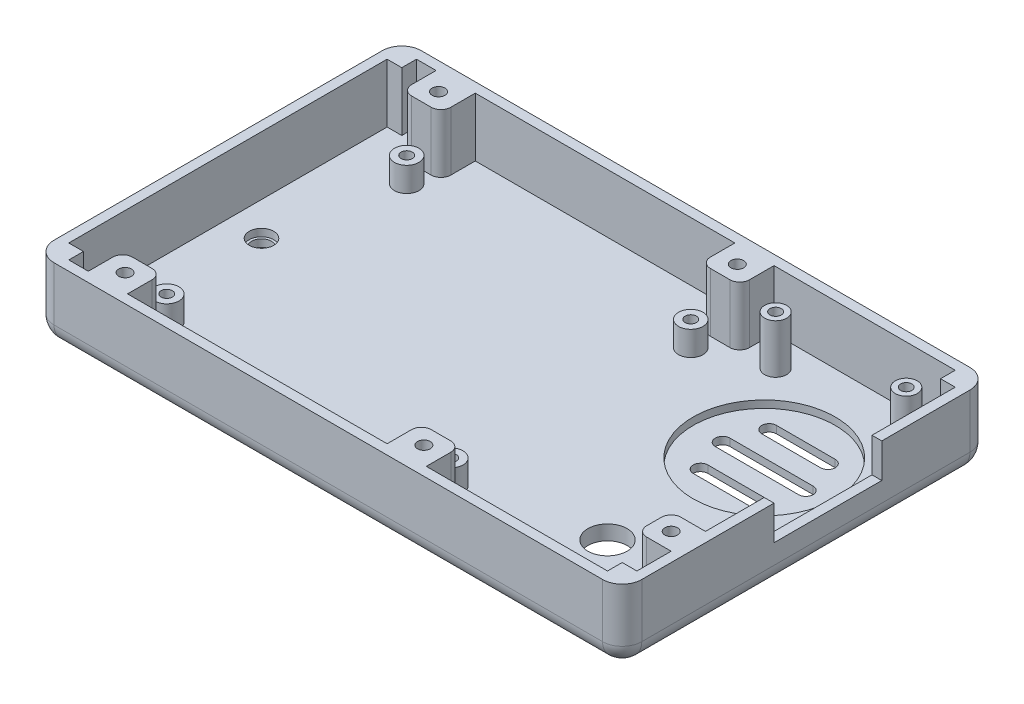
from build123d import *

# Parameters (mm, degrees)
SKETCH1_W                   = 120
SKETCH1_H                   = 75
MAIN_STRUCTURE_DEPTH        = 15
SKETCH2_W                   = 116
SKETCH2_H                   = 71
INSIDE_CUT_DEPTH            = 12
SKETCH3_R                   = 2.5
SKETCH3_R_2                 = 1.15
PI_STANDOFFS_DEPTH          = 5
SKETCH4_R                   = 2
SKETCH4_R_2                 = 0.9
CAMERA_STANDOFFS_DEPTH      = 5
BODY_FILLET_1_R             = 4
BODY_FILLET_2_R             = 4
BODY_FILLET_3_R             = 4
BODY_FILLET_4_R             = 4
SKETCH5_R                   = 2.25
SKETCH5_R_2                 = 1.15
FONA_STANDOFFS_DEPTH        = 10
SKETCH6_W                   = 3
SKETCH6_H                   = 3
CORNER_SUPPORT_DEPTH        = 12
SKETCH8_W                   = 22
SKETCH8_H                   = 7
CHARGER_CUTOUT_DEPTH        = 10
SKETCH9_W                   = 8
SKETCH9_H                   = 7
SKETCH9_W_2                 = 7
MOUNTING_STRUCTURE_DEPTH    = 12
MOUNTING_STRUCTURE_FILLET_R = 2
SKETCH10_R                  = 1.3
CASE_MOUNTING_HOLES_DEPTH   = 15
SKETCH13_R                  = 2.9
CASE_SCREW_HEAD_HOLES_DEPTH = 8.85
SKETCH14_R                  = 14.5
SPEAKER_HOLDER_DEPTH        = 1.5
SOUND_CUTOUT_DEPTH          = 1.5
SKETCH25_R                  = 2.5
MICROPHONE_HOLDER_DEPTH     = 1.5
SKETCH26_R                  = 2
MICROPHONE_CUTOUT_DEPTH     = 1.5
SKETCH27_R                  = 4
CAMERA_CUTOUT_DEPTH         = 10


with BuildPart() as part:
    # Sketch1 → Main Structure (new body)
    with BuildSketch(Plane(origin=(0, 0, 0), x_dir=(1, 0, 0), z_dir=(0, 1, 0))):
        Rectangle(SKETCH1_W, SKETCH1_H)
    extrude(amount=MAIN_STRUCTURE_DEPTH)

    # Sketch2 → Inside Cut (cut)
    with BuildSketch(Plane(origin=(0, 15, 0), x_dir=(1, 0, 0), z_dir=(0, 1, 0))):
        Rectangle(SKETCH2_W, SKETCH2_H)
    extrude(amount=-INSIDE_CUT_DEPTH, mode=Mode.SUBTRACT)

    # Sketch3 → Pi Standoffs (add)
    # profile 1 of 4: a face of its own
    with BuildSketch(Plane(origin=(0, 3, 0), x_dir=(1, 0, 0), z_dir=(0, 1, 0))):
        with Locations((-46, -24.5)):
            Circle(SKETCH3_R)
        with Locations((-46, -24.5)):
            Circle(SKETCH3_R_2, mode=Mode.SUBTRACT)
    # profile 2 of 4: a face of its own
    with BuildSketch(Plane(origin=(0, 3, 0), x_dir=(1, 0, 0), z_dir=(0, 1, 0))):
        with Locations((-46, 24.5)):
            Circle(SKETCH3_R)
        with Locations((-46, 24.5)):
            Circle(SKETCH3_R_2, mode=Mode.SUBTRACT)
    # profile 3 of 4: a face of its own
    with BuildSketch(Plane(origin=(0, 3, 0), x_dir=(1, 0, 0), z_dir=(0, 1, 0))):
        with Locations((12, 24.5)):
            Circle(SKETCH3_R)
        with Locations((12, 24.5)):
            Circle(SKETCH3_R_2, mode=Mode.SUBTRACT)
    # profile 4 of 4: a face of its own
    with BuildSketch(Plane(origin=(0, 3, 0), x_dir=(1, 0, 0), z_dir=(0, 1, 0))):
        with Locations((12, -24.5)):
            Circle(SKETCH3_R)
        with Locations((12, -24.5)):
            Circle(SKETCH3_R_2, mode=Mode.SUBTRACT)
    extrude(amount=PI_STANDOFFS_DEPTH)

    # Sketch4 → Camera Standoffs (add)
    # profile 1 of 2: a face of its own
    with BuildSketch(Plane(origin=(0, 3, 0), x_dir=(1, 0, 0), z_dir=(0, 1, 0))):
        with Locations((48, -30.5)):
            Circle(SKETCH4_R)
        with Locations((48, -30.5)):
            Circle(SKETCH4_R_2, mode=Mode.SUBTRACT)
    # profile 2 of 2: a face of its own
    with BuildSketch(Plane(origin=(0, 3, 0), x_dir=(1, 0, 0), z_dir=(0, 1, 0))):
        with Locations((48, -17.5)):
            Circle(SKETCH4_R)
        with Locations((48, -17.5)):
            Circle(SKETCH4_R_2, mode=Mode.SUBTRACT)
    extrude(amount=CAMERA_STANDOFFS_DEPTH)

    # Body Fillet 1
    body_fillet_1_edges = [part.edges().sort_by_distance(p)[0] for p in [
        (-60, 0, 0),
    ]]
    fillet(body_fillet_1_edges, radius=BODY_FILLET_1_R)

    # Body Fillet 2
    body_fillet_2_edges = [part.edges().sort_by_distance(p)[0] for p in [
        (-60, 9.5, -37.5),
        (-58.828427125, 1.171572875, -37.5),
        (2, 0, -37.5),
    ]]
    fillet(body_fillet_2_edges, radius=BODY_FILLET_2_R)

    # Body Fillet 3
    body_fillet_3_edges = [part.edges().sort_by_distance(p)[0] for p in [
        (-60, 9.5, 37.5),
        (-58.828427125, 1.171572875, 37.5),
        (2, 0, 37.5),
    ]]
    fillet(body_fillet_3_edges, radius=BODY_FILLET_3_R)

    # Body Fillet 4
    body_fillet_4_edges = [part.edges().sort_by_distance(p)[0] for p in [
        (60, 9.5, 37.5),
        (60, 1.171572875, 36.328427125),
        (60, 9.5, -37.5),
        (60, 1.171572875, -36.328427125),
        (60, 0, 0),
    ]]
    fillet(body_fillet_4_edges, radius=BODY_FILLET_4_R)

    # Sketch5 → Fona Standoffs (add)
    # profile 1 of 2: a face of its own
    with BuildSketch(Plane(origin=(0, 3, 0), x_dir=(1, 0, 0), z_dir=(0, 1, 0))):
        with Locations((24.33, 29.5)):
            Circle(SKETCH5_R)
        with Locations((24.33, 29.5)):
            Circle(SKETCH5_R_2, mode=Mode.SUBTRACT)
    # profile 2 of 2: a face of its own
    with BuildSketch(Plane(origin=(0, 3, 0), x_dir=(1, 0, 0), z_dir=(0, 1, 0))):
        with Locations((51, 29.5)):
            Circle(SKETCH5_R)
        with Locations((51, 29.5)):
            Circle(SKETCH5_R_2, mode=Mode.SUBTRACT)
    extrude(amount=FONA_STANDOFFS_DEPTH)

    # Sketch6 → Corner Support (add)
    with BuildSketch(Plane(origin=(0, 3, 0), x_dir=(1, 0, 0), z_dir=(0, 1, 0))):
        with Locations((-56.5, -34)):
            Rectangle(SKETCH6_W, SKETCH6_H)
        with Locations((-56.5, 34)):
            Rectangle(SKETCH6_W, SKETCH6_H)
        with Locations((56.5, -34)):
            Rectangle(SKETCH6_W, SKETCH6_H)
        with Locations((56.5, 34)):
            Rectangle(SKETCH6_W, SKETCH6_H)
    extrude(amount=CORNER_SUPPORT_DEPTH)

    # Sketch8 → Charger Cutout (cut)
    with BuildSketch(Plane(origin=(60, 0, 0), x_dir=(0, 0, -1), z_dir=(1, 0, 0))):
        with Locations((4.5, 11.5)):
            Rectangle(SKETCH8_W, SKETCH8_H)
    extrude(amount=-CHARGER_CUTOUT_DEPTH, mode=Mode.SUBTRACT)

    # Sketch9 → Mounting Structure (add)
    with BuildSketch(Plane(origin=(0, 3, 0), x_dir=(1, 0, 0), z_dir=(0, 1, 0))):
        with Locations((-47, -32)):
            Rectangle(SKETCH9_W, SKETCH9_H)
        with Locations((54.5, -22)):
            Rectangle(SKETCH9_W_2, SKETCH9_H)
        with Locations((-47, 32)):
            Rectangle(SKETCH9_W, SKETCH9_H)
        with Locations((14, 32)):
            Rectangle(SKETCH9_W, SKETCH9_H)
        with Locations((14, -32)):
            Rectangle(SKETCH9_W, SKETCH9_H)
    extrude(amount=MOUNTING_STRUCTURE_DEPTH)

    # Mounting Structure Fillet
    mounting_structure_fillet_edges = [part.edges().sort_by_distance(p)[0] for p in [
        (-43, 9, -28.5),
        (-51, 9, -28.5),
        (10, 9, -28.5),
        (18, 9, -28.5),
        (10, 9, 28.5),
        (18, 9, 28.5),
        (-51, 9, 28.5),
        (-43, 9, 28.5),
        (51, 9, 18.5),
        (51, 9, 25.5),
    ]]
    fillet(mounting_structure_fillet_edges, radius=MOUNTING_STRUCTURE_FILLET_R)

    # Sketch10 → Case Mounting Holes (cut)
    with BuildSketch(Plane(origin=(0, 15, 0), x_dir=(1, 0, 0), z_dir=(0, 1, 0))):
        with Locations((-47, 32)):
            Circle(SKETCH10_R)
        with Locations((-47, -32)):
            Circle(SKETCH10_R)
        with Locations((14, -32)):
            Circle(SKETCH10_R)
        with Locations((14, 32)):
            Circle(SKETCH10_R)
        with Locations((54.5, -22)):
            Circle(SKETCH10_R)
    extrude(amount=-CASE_MOUNTING_HOLES_DEPTH, mode=Mode.SUBTRACT)

    # Sketch13 → Case Screw Head Holes (cut)
    with BuildSketch(Plane.XZ):
        with Locations((-47, 32)):
            Circle(SKETCH13_R)
        with Locations((14, 32)):
            Circle(SKETCH13_R)
        with Locations((14, -32)):
            Circle(SKETCH13_R)
        with Locations((-47, -32)):
            Circle(SKETCH13_R)
        with Locations((54.5, 22)):
            Circle(SKETCH13_R)
    extrude(amount=-CASE_SCREW_HEAD_HOLES_DEPTH, mode=Mode.SUBTRACT)

    # Sketch14 → Speaker Holder (cut)
    with BuildSketch(Plane(origin=(0, 3, 0), x_dir=(1, 0, 0), z_dir=(0, 1, 0))):
        with Locations((39, 12.5)):
            Circle(SKETCH14_R)
    extrude(amount=-SPEAKER_HOLDER_DEPTH, mode=Mode.SUBTRACT)

    # Sketch23 → Sound Cutout (cut)
    with BuildSketch(Plane(origin=(0, 1.5, 0), x_dir=(1, 0, 0), z_dir=(0, 1, 0))):
        with BuildLine():
            Line((33, 21), (45, 21))
            ThreePointArc((45, 21), (46.5, 19.5), (45, 18))
            Line((45, 18), (33, 18))
            ThreePointArc((33, 18), (31.5, 19.5), (33, 21))
        make_face()
        with BuildLine():
            Line((30.5, 14), (47.5, 14))
            ThreePointArc((47.5, 14), (49, 12.5), (47.5, 11))
            Line((47.5, 11), (30.5, 11))
            ThreePointArc((30.5, 11), (29, 12.5), (30.5, 14))
        make_face()
        with BuildLine():
            Line((33, 7), (45, 7))
            ThreePointArc((45, 7), (46.5, 5.5), (45, 4))
            Line((45, 4), (33, 4))
            ThreePointArc((33, 4), (31.5, 5.5), (33, 7))
        make_face()
    extrude(amount=-SOUND_CUTOUT_DEPTH, mode=Mode.SUBTRACT)

    # Sketch25 → Microphone holder (cut)
    with BuildSketch(Plane(origin=(0, 3, 0), x_dir=(1, 0, 0), z_dir=(0, 1, 0))):
        with Locations((-51.147743093, 0)):
            Circle(SKETCH25_R)
    extrude(amount=-MICROPHONE_HOLDER_DEPTH, mode=Mode.SUBTRACT)

    # Sketch26 → Microphone Cutout (cut)
    with BuildSketch(Plane(origin=(0, 1.5, 0), x_dir=(1, 0, 0), z_dir=(0, 1, 0))):
        with Locations((-51.147743093, 0)):
            Circle(SKETCH26_R)
    extrude(amount=-MICROPHONE_CUTOUT_DEPTH, mode=Mode.SUBTRACT)

    # Sketch27 → Camera Cutout (cut)
    with BuildSketch(Plane(origin=(0, 3, 0), x_dir=(1, 0, 0), z_dir=(0, 1, 0))):
        with Locations((37.5, -18)):
            Circle(SKETCH27_R)
    extrude(amount=-CAMERA_CUTOUT_DEPTH, mode=Mode.SUBTRACT)


solid = part.part
